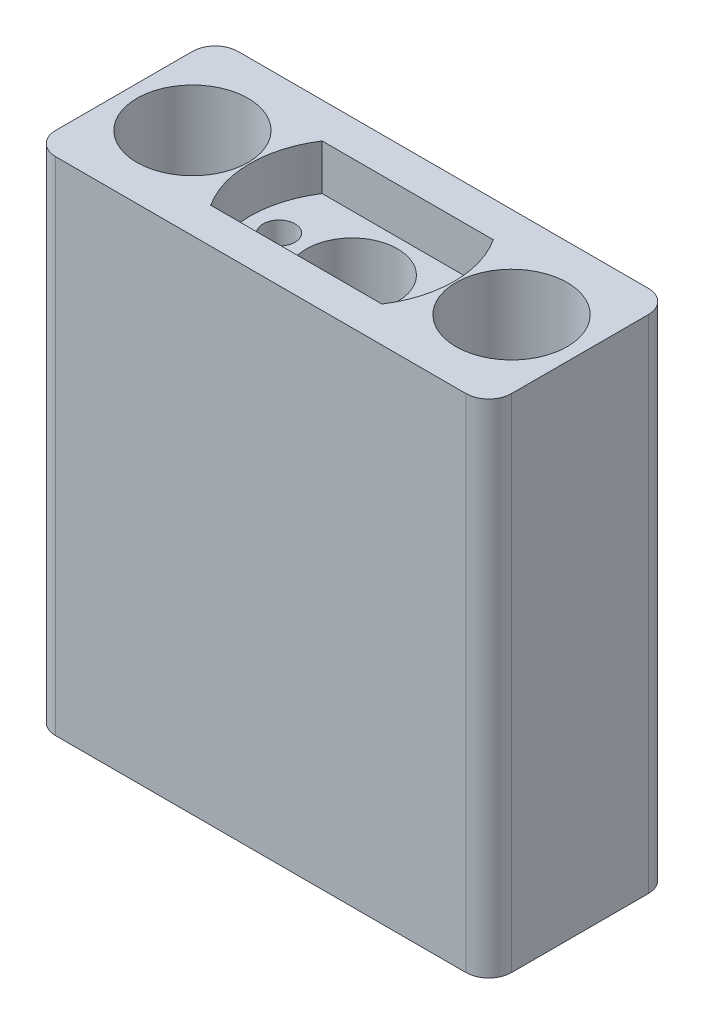
from build123d import *

# Parameters (mm, degrees)
SKETCH_1_W          = 50
SKETCH_1_H          = 20
EXTRUDE_1_DEPTH     = 55
CUT_EXTRUDE_1_DEPTH = 5
SKETCH_3_R          = 5
CUT_EXTRUDE_2_DEPTH = 57.789083458
SKETCH_4_R          = 6.1
CUT_EXTRUDE_3_DEPTH = 20
SKETCH_5_R          = 4
CUT_EXTRUDE_4_DEPTH = 45.158804332
SKETCH_6_R          = 1.75
CUT_EXTRUDE_5_DEPTH = 7
CUT_EXTRUDE_START   = -20
SKETCH_7_R          = 6.1
CUT_EXTRUDE_6_DEPTH = 20
FILLET_1_R          = 2.5


with BuildPart() as part:
    # 草图1 → 凸台-拉伸1 (new body)
    with BuildSketch(Plane(origin=(0, 0, 0), x_dir=(1, 0, 0), z_dir=(0, 1, 0))):
        Rectangle(SKETCH_1_W, SKETCH_1_H)
    extrude(amount=EXTRUDE_1_DEPTH)

    # 草图2 → 切除-拉伸1 (cut)
    with BuildSketch(Plane(origin=(0, 55, 0), x_dir=(1, 0, 0), z_dir=(0, 1, 0))):
        with BuildLine():
            Line((-9.387172538, 6.109090909), (9.387172538, 6.109090909))
            ThreePointArc((9.387172538, 6.109090909), (11.2, 0), (9.387172538, -6.109090909))
            Line((9.387172538, -6.109090909), (-9.387172538, -6.109090909))
            ThreePointArc((-9.387172538, -6.109090909), (-11.2, 0), (-9.387172538, 6.109090909))
        make_face()
    extrude(amount=-CUT_EXTRUDE_1_DEPTH, mode=Mode.SUBTRACT)

    # 草图3 → 切除-拉伸2 (cut, through all)
    with BuildSketch(Plane(origin=(0, 50, 0), x_dir=(1, 0, 0), z_dir=(0, 1, 0))):
        Circle(SKETCH_3_R)
    extrude(amount=-CUT_EXTRUDE_2_DEPTH, mode=Mode.SUBTRACT)

    # 草图4 → 切除-拉伸3 (cut)
    with BuildSketch(Plane(origin=(0, 55, 0), x_dir=(1, 0, 0), z_dir=(0, 1, 0))):
        with Locations((17.5, 0)):
            Circle(SKETCH_4_R)
        with Locations((-17.5, 0)):
            Circle(SKETCH_4_R)
    extrude(amount=-CUT_EXTRUDE_3_DEPTH, mode=Mode.SUBTRACT)

    # 草图5 → 切除-拉伸4 (cut, through all)
    with BuildSketch(Plane(origin=(0, 35, 0), x_dir=(1, 0, 0), z_dir=(0, 1, 0))):
        with Locations((-17.5, 0)):
            Circle(SKETCH_5_R)
        with Locations((17.5, 0)):
            Circle(SKETCH_5_R)
    extrude(amount=-CUT_EXTRUDE_4_DEPTH, mode=Mode.SUBTRACT)

    # 草图6 → 切除-拉伸5 (cut)
    with BuildSketch(Plane(origin=(0, 50, 0), x_dir=(1, 0, 0), z_dir=(0, 1, 0))):
        with Locations((8, 0)):
            Circle(SKETCH_6_R)
        with Locations((-8, 0)):
            Circle(SKETCH_6_R)
    extrude(amount=-CUT_EXTRUDE_5_DEPTH, mode=Mode.SUBTRACT)

    # 草图7 → 切除-拉伸6 (cut)
    with BuildSketch(Plane.XZ.offset(CUT_EXTRUDE_START)):
        with Locations((-17.5, 0)):
            Circle(SKETCH_7_R)
        with Locations((17.5, 0)):
            Circle(SKETCH_7_R)
    extrude(amount=CUT_EXTRUDE_6_DEPTH, mode=Mode.SUBTRACT)

    # 圆角1
    fillet_1_edges = [part.edges().sort_by_distance(p)[0] for p in [
        (25, 27.5, 10),
        (25, 27.5, -10),
        (-25, 27.5, 10),
        (-25, 27.5, -10),
    ]]
    fillet(fillet_1_edges, radius=FILLET_1_R)


solid = part.part
